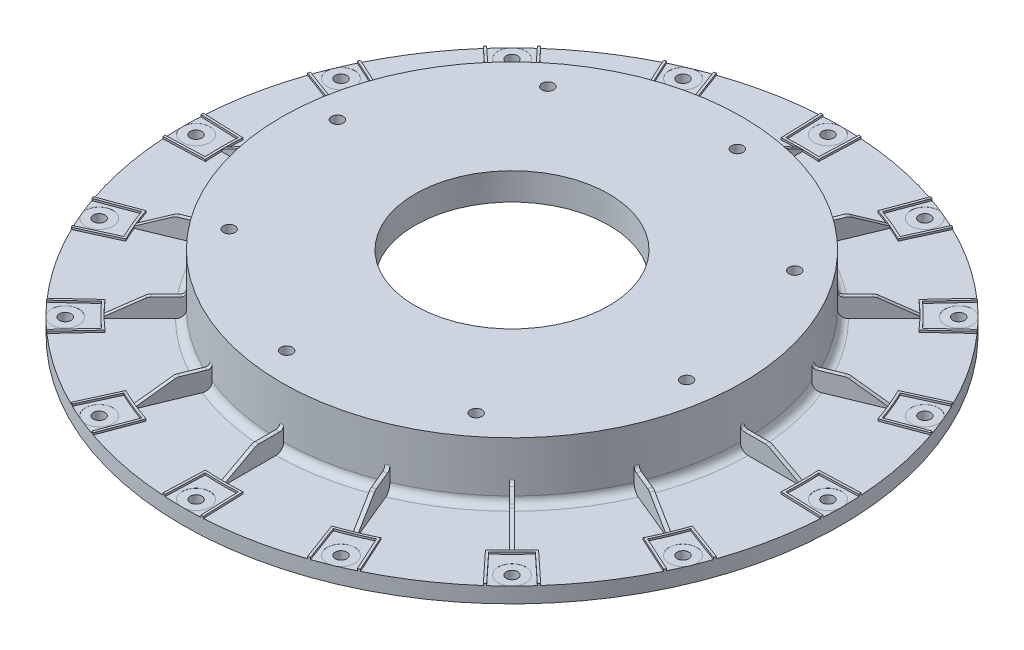
from build123d import *
from build123d.topology import SkipClean

# Parameters (mm, degrees)
SKETCH_1_R               = 85
EXTRUDE_1_DEPTH          = 5
SKETCH_2_R               = 1.5
CUT_EXTRUDE_1_DEPTH      = 50
PATTERN_CIRCULAR_1_COUNT = 16
SKETCH_3_R               = 3.55
CUT_EXTRUDE_3_DEPTH      = 0.02
PATTERN_CIRCULAR_2_COUNT = 16
EXTRUDE_2_DEPTH          = 0.5
PATTERN_CIRCULAR_3_COUNT = 16
SKETCH_6_R               = 59.4
EXTRUDE_3_DEPTH          = 20
SKETCH_7_R               = 54.4
CUT_EXTRUDE_4_DEPTH      = 50
SKETCH_9_R               = 56.4
CUT_EXTRUDE_5_DEPTH      = 500
SKETCH_10_R              = 58.520131601
SKETCH_10_R_2            = 25
EXTRUDE_5_DEPTH          = 2
FILLET_3_R               = 2
EXTRUDE_6_DEPTH          = 0.5
PATTERN_CIRCULAR_5_COUNT = 16
FILLET_11_R              = 2
FILLET_14_R              = 1
FILLET_16_R              = 1
FILLET_17_R              = 1
FILLET_18_R              = 1
FILLET_19_R              = 2
FILLET_20_R              = 2
SKETCH_11_R              = 1.5
CUT_EXTRUDE_6_DEPTH      = 50
PATTERN_CIRCULAR_6_COUNT = 8
SKETCH_15_R              = 56.4
EXTRUDE_7_DEPTH          = 10
SKETCH_16_R              = 25
CUT_EXTRUDE_7_DEPTH      = 500
SKETCH_17_R              = 1.5
CUT_EXTRUDE_8_DEPTH      = 500
PATTERN_CIRCULAR_7_COUNT = 8
CUT_EXTRUDE_START        = -5
SKETCH_18_R              = 59.4
CUT_EXTRUDE_9_DEPTH      = 5
SKETCH_19_R              = 100.21755155
CUT_EXTRUDE_10_DEPTH     = 1


with BuildPart() as part:
    # 草图1 → 凸台-拉伸1 (new body)
    with BuildSketch(Plane(origin=(0, 0, 0), x_dir=(1, 0, 0), z_dir=(0, 1, 0))):
        Circle(SKETCH_1_R)
    extrude(amount=EXTRUDE_1_DEPTH)

    # 草图2 → 切除-拉伸1 (cut)
    with BuildSketch(Plane(origin=(0, 5, 0), x_dir=(1, 0, 0), z_dir=(0, 1, 0))):
        with Locations((-81.5, 0)):
            Circle(SKETCH_2_R)
    cut_extrude_1 = extrude(amount=-CUT_EXTRUDE_1_DEPTH, mode=Mode.SUBTRACT)

    # 阵列(圆周)1: 切除-拉伸1 ×16 about axis
    pattern_circular_1_axis = Axis((0, 5, 0), (0, 1, 0))
    for i in range(1, PATTERN_CIRCULAR_1_COUNT):
        add(cut_extrude_1.rotate(pattern_circular_1_axis, i * 360 / PATTERN_CIRCULAR_1_COUNT), mode=Mode.SUBTRACT)

    # 草图3 → 切除-拉伸3 (cut)
    with BuildSketch(Plane(origin=(0, 5, 0), x_dir=(1, 0, 0), z_dir=(0, 1, 0))):
        with Locations((-75.2961819, -31.188699738)):
            Circle(SKETCH_3_R)
    cut_extrude_3 = extrude(amount=-CUT_EXTRUDE_3_DEPTH, mode=Mode.SUBTRACT)

    # 阵列(圆周)2: 切除-拉伸3 ×16 about axis
    pattern_circular_2_axis = Axis((0, 5, 0), (0, -1, 0))
    for i in range(1, PATTERN_CIRCULAR_2_COUNT):
        add(cut_extrude_3.rotate(pattern_circular_2_axis, i * 360 / PATTERN_CIRCULAR_2_COUNT), mode=Mode.SUBTRACT)

    # 草图4 → 凸台-拉伸2 (add)
    with SkipClean():  # the faces are left unmerged after this step: merging them gives an invalid solid
        with BuildSketch(Plane(origin=(0, 5, 0), x_dir=(1, 0, 0), z_dir=(0, 1, 0))):
            with BuildLine():
                Line((-74.878726662, 4.263366447), (-84.874077919, 4.625029445))
                ThreePointArc((-84.874077919, 4.625029445), (-84.857221525, 4.924627401), (-84.83930758, 5.224163982))
                Line((-84.83930758, 5.224163982), (-74.242355177, 4.840733178))
                ThreePointArc((-74.242355177, 4.840733178), (-74.4, 0), (-74.242355177, -4.840733178))
                Line((-74.242355177, -4.840733178), (-84.83930758, -5.224163982))
                ThreePointArc((-84.83930758, -5.224163982), (-84.857221525, -4.924627401), (-84.874077919, -4.625029445))
                Line((-84.874077919, -4.625029445), (-74.878726662, -4.263366447))
                ThreePointArc((-74.878726662, -4.263366447), (-75, 0), (-74.878726662, 4.263366447))
            make_face()
        extrude_2 = extrude(amount=EXTRUDE_2_DEPTH)

    # 阵列(圆周)3: 凸台-拉伸2 ×16 about axis
    with SkipClean():  # the faces are left unmerged after this step: merging them gives an invalid solid
        pattern_circular_3_axis = Axis((0, 5, 0), (0, -1, 0))
        for i in range(1, PATTERN_CIRCULAR_3_COUNT):
            add(extrude_2.rotate(pattern_circular_3_axis, i * 360 / PATTERN_CIRCULAR_3_COUNT))

    # 草图6 → 凸台-拉伸3 (add)
    with SkipClean():  # the faces are left unmerged after this step: merging them gives an invalid solid
        with BuildSketch(Plane(origin=(0, 5, 0), x_dir=(1, 0, 0), z_dir=(0, 1, 0))):
            Circle(SKETCH_6_R)
        extrude(amount=EXTRUDE_3_DEPTH)

    # 草图7 → 切除-拉伸4 (cut)
    with SkipClean():  # the faces are left unmerged after this step: merging them gives an invalid solid
        with BuildSketch(Plane(origin=(0, 25, 0), x_dir=(1, 0, 0), z_dir=(0, 1, 0))):
            Circle(SKETCH_7_R)
        extrude(amount=-CUT_EXTRUDE_4_DEPTH, mode=Mode.SUBTRACT)

    # 草图9 → 切除-拉伸5 (cut)
    with SkipClean():  # the faces are left unmerged after this step: merging them gives an invalid solid
        with BuildSketch(Plane(origin=(0, 25, 0), x_dir=(1, 0, 0), z_dir=(0, 1, 0))):
            Circle(SKETCH_9_R)
        extrude(amount=-CUT_EXTRUDE_5_DEPTH, mode=Mode.SUBTRACT)

    # 草图10 → 凸台-拉伸5 (add)
    with SkipClean():  # the faces are left unmerged after this step: merging them gives an invalid solid
        with BuildSketch(Plane(origin=(0, 25, 0), x_dir=(1, 0, 0), z_dir=(0, 1, 0))):
            Circle(SKETCH_10_R)
            Circle(SKETCH_10_R_2, mode=Mode.SUBTRACT)
        extrude(amount=-EXTRUDE_5_DEPTH)

    # 圆角3
    fillet_3_edges = [part.edges().sort_by_distance(p)[0] for p in [
        (-59.4, 5, 0),
    ]]
    fillet(fillet_3_edges, radius=FILLET_3_R)

    # 草图8 → 凸台-拉伸6 (add, symmetric)
    with SkipClean():  # the faces are left unmerged after this step: merging them gives an invalid solid
        with BuildSketch(Plane.XY):
            Polygon((-74.4, 5.5), (-66.33892646, 9.820584794), (-59.4, 9.820584794), (-57.9, 9.820584794), (-57.9, 5), (-74.321177589, 5), (-74.65775518, 5), (-74.65775518, 5.5), align=None)
        extrude_6 = extrude(amount=EXTRUDE_6_DEPTH, both=True)

    # 阵列(圆周)5: 凸台-拉伸6 ×16 about axis
    with SkipClean():  # the faces are left unmerged after this step: merging them gives an invalid solid
        pattern_circular_5_axis = Axis((0, 5, 0), (0, -1, 0))
        for i in range(1, PATTERN_CIRCULAR_5_COUNT):
            add(extrude_6.rotate(pattern_circular_5_axis, i * 360 / PATTERN_CIRCULAR_5_COUNT))

    # 圆角11
    fillet_11_edges = [part.edges().sort_by_distance(p)[0] for p in [
        (-66.33892646, 9.820584794, 0),
    ]]
    fillet(fillet_11_edges, radius=FILLET_11_R)

    # 圆角14
    fillet_14_edges = [part.edges().sort_by_distance(p)[0] for p in [
        (-59.4, 9.820584794, 0),
    ]]
    fillet(fillet_14_edges, radius=FILLET_14_R)

    # 圆角16
    fillet_16_edges = [part.edges().sort_by_distance(p)[0] for p in [
        (-54.878444231, 9.820584794, 22.731395882),
    ]]
    fillet(fillet_16_edges, radius=FILLET_16_R)

    # 圆角17
    fillet_17_edges = [part.edges().sort_by_distance(p)[0] for p in [
        (59.399473894, 9.820584794, -0.250002214),
        (54.878444231, 9.820584794, 22.731395882),
        (42.002142802, 9.820584794, 42.002142802),
        (22.731395882, 9.820584794, 54.878444231),
        (0, 9.820584794, 59.4),
        (-22.731395882, 9.820584794, 54.878444231),
        (-42.002142802, 9.820584794, 42.002142802),
    ]]
    fillet(fillet_17_edges, radius=FILLET_17_R)

    # 圆角18
    fillet_18_edges = [part.edges().sort_by_distance(p)[0] for p in [
        (-54.878444231, 9.820584794, -22.731395882),
        (-42.002142802, 9.820584794, -42.002142802),
        (-22.731395882, 9.820584794, -54.878444231),
        (0, 9.820584794, -59.4),
        (22.731395882, 9.820584794, -54.878444231),
        (42.002142802, 9.820584794, -42.002142802),
        (54.878444231, 9.820584794, -22.731395882),
    ]]
    fillet(fillet_18_edges, radius=FILLET_18_R)

    # 圆角19
    fillet_19_edges = [part.edges().sort_by_distance(p)[0] for p in [
        (66.33892646, 9.820584794, 0),
        (61.289176365, 9.820584794, 25.386808077),
        (46.908704756, 9.820584794, 46.908704756),
        (25.386808077, 9.820584794, 61.289176365),
        (0, 9.820584794, 66.33892646),
        (-25.386808077, 9.820584794, 61.289176365),
        (-46.908704756, 9.820584794, 46.908704756),
        (-61.289176365, 9.820584794, 25.386808077),
    ]]
    fillet(fillet_19_edges, radius=FILLET_19_R)

    # 圆角20
    fillet_20_edges = [part.edges().sort_by_distance(p)[0] for p in [
        (-61.289176365, 9.820584794, -25.386808077),
        (-46.908704756, 9.820584794, -46.908704756),
        (-25.386808077, 9.820584794, -61.289176365),
        (0, 9.820584794, -66.33892646),
        (25.386808077, 9.820584794, -61.289176365),
        (46.908704756, 9.820584794, -46.908704756),
        (61.289176365, 9.820584794, -25.386808077),
    ]]
    fillet(fillet_20_edges, radius=FILLET_20_R)

    # 草图11 → 切除-拉伸6 (cut)
    with BuildSketch(Plane(origin=(0, 25, 0), x_dir=(1, 0, 0), z_dir=(0, 1, 0))):
        with Locations((51.58694432, -6.541190696)):
            Circle(SKETCH_11_R)
    cut_extrude_6 = extrude(amount=-CUT_EXTRUDE_6_DEPTH, mode=Mode.SUBTRACT)

    # 阵列(圆周)6: 切除-拉伸6 ×8 about axis
    pattern_circular_6_axis = Axis((0, 23, 0), (0, 1, 0))
    for i in range(1, PATTERN_CIRCULAR_6_COUNT):
        add(cut_extrude_6.rotate(pattern_circular_6_axis, i * 360 / PATTERN_CIRCULAR_6_COUNT), mode=Mode.SUBTRACT)

    # 草图15 → 凸台-拉伸7 (add)
    with BuildSketch(Plane.XZ.offset(-23)):
        Circle(SKETCH_15_R)
    extrude(amount=EXTRUDE_7_DEPTH)

    # 草图16 → 切除-拉伸7 (cut)
    with BuildSketch(Plane(origin=(0, 25, 0), x_dir=(1, 0, 0), z_dir=(0, 1, 0))):
        Circle(SKETCH_16_R)
    extrude(amount=-CUT_EXTRUDE_7_DEPTH, mode=Mode.SUBTRACT)

    # 草图17 → 切除-拉伸8 (cut)
    with BuildSketch(Plane(origin=(0, 25, 0), x_dir=(1, 0, 0), z_dir=(0, 1, 0))):
        with Locations((-51.58694432, 6.541190696)):
            Circle(SKETCH_17_R)
    cut_extrude_8 = extrude(amount=-CUT_EXTRUDE_8_DEPTH, mode=Mode.SUBTRACT)

    # 阵列(圆周)7: 切除-拉伸8 ×8 about axis
    pattern_circular_7_axis = Axis((0, 25, 0), (0, -1, 0))
    for i in range(1, PATTERN_CIRCULAR_7_COUNT):
        add(cut_extrude_8.rotate(pattern_circular_7_axis, i * 360 / PATTERN_CIRCULAR_7_COUNT), mode=Mode.SUBTRACT)

    # 草图18 → 切除-拉伸9 (cut)
    with BuildSketch(Plane(origin=(0, 25, 0), x_dir=(1, 0, 0), z_dir=(0, 1, 0)).offset(CUT_EXTRUDE_START)):
        Circle(SKETCH_18_R)
    extrude(amount=CUT_EXTRUDE_9_DEPTH, mode=Mode.SUBTRACT)

    # 草图19 → 切除-拉伸10 (cut)
    with BuildSketch(Plane.XZ):
        Circle(SKETCH_19_R)
    extrude(amount=-CUT_EXTRUDE_10_DEPTH, mode=Mode.SUBTRACT)


solid = part.part
